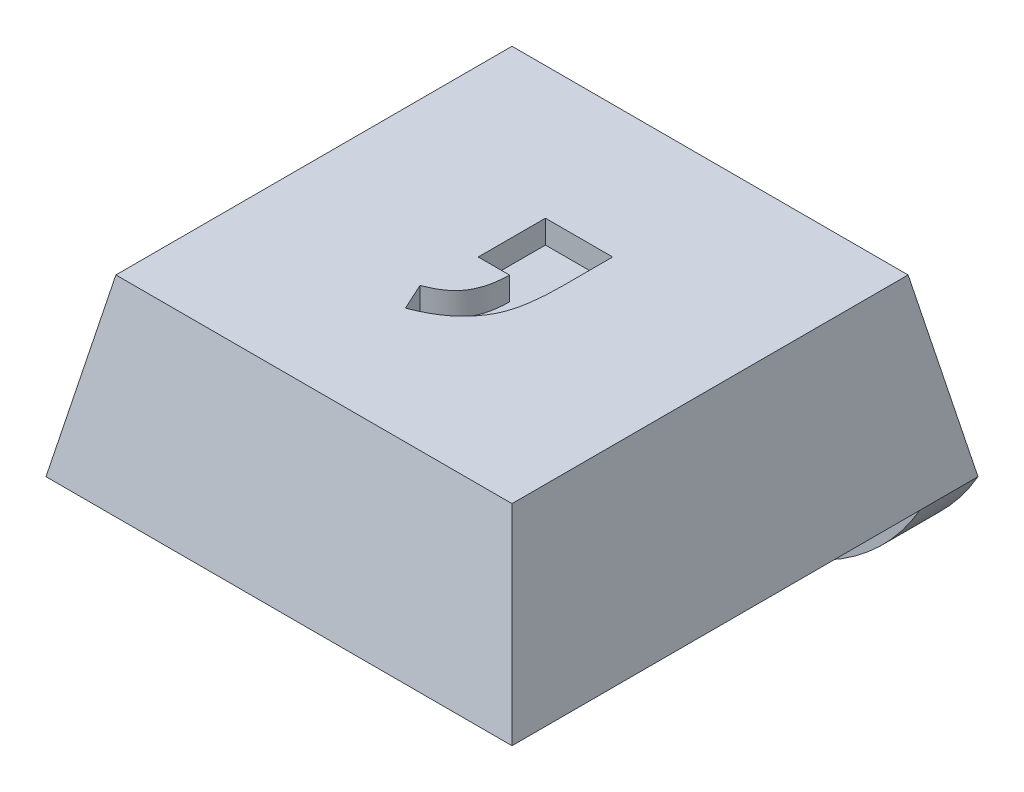
from build123d import *

# Parameters (mm, degrees)
SKETCH1_W               = 8
SKETCH1_H               = 8
BOSS_EXTRUDE1_DEPTH     = 3
CUT_EXTRUDE1_DEPTH      = 12.704699911
CUT_EXTRUDE1_DEPTH_BACK = 12.704699911
CUT_EXTRUDE2_DEPTH      = 11
SKETCH4_R               = 1.8
CUT_EXTRUDE3_DEPTH      = 0.8
SKETCH5_W               = 8
SKETCH5_H               = 1
BOSS_EXTRUDE2_DEPTH     = 2
FILLET1_R               = 4
CUT_EXTRUDE4_DEPTH      = 0.4


with BuildPart() as part:
    # Sketch1 → Boss-Extrude1 (new body)
    with BuildSketch(Plane(origin=(0, 0, 0), x_dir=(1, 0, 0), z_dir=(0, 1, 0))):
        with Locations((4, 4)):
            Rectangle(SKETCH1_W, SKETCH1_H)
    extrude(amount=BOSS_EXTRUDE1_DEPTH)

    # Sketch2 → Cut-Extrude1 (cut, two sides: drawn at the far end of the back side and taken through both)
    with BuildSketch(Plane.XY.offset(-CUT_EXTRUDE1_DEPTH_BACK)):
        Polygon((0, 0), (0.6, 3), (0, 3), align=None)
        Polygon((8, 0), (7.4, 3), (8, 3), align=None)
    extrude(amount=CUT_EXTRUDE1_DEPTH + CUT_EXTRUDE1_DEPTH_BACK, mode=Mode.SUBTRACT)

    # Sketch3 → Cut-Extrude2 (cut)
    with BuildSketch(Plane(origin=(0, 0, 0), x_dir=(0, 0, -1), z_dir=(1, 0, 0))):
        Polygon((0, 0), (0.6, 3), (0, 3), align=None)
        Polygon((8, 3), (7.4, 3), (8, 0), align=None)
    extrude(amount=CUT_EXTRUDE2_DEPTH, mode=Mode.SUBTRACT)

    # Sketch4 → Cut-Extrude3 (cut)
    with BuildSketch(Plane.XZ):
        with Locations(Location((4, -3.75, 0), (0, 0, 270))):
            Circle(SKETCH4_R)
    extrude(amount=-CUT_EXTRUDE3_DEPTH, mode=Mode.SUBTRACT)

    # Sketch5 → Boss-Extrude2 (add)
    with BuildSketch(Plane.XZ):
        with Locations((4, -7.5)):
            Rectangle(SKETCH5_W, SKETCH5_H)
    extrude(amount=BOSS_EXTRUDE2_DEPTH)

    # Fillet1
    # the kernel refuses this fillet: 4 mm, written as the material it takes off along each edge
    with BuildSketch(Plane(origin=(8, -2, -16.660254038), x_dir=(0, 1, 0), z_dir=(0, 0, 1)), Plane(origin=(0, -2, 1.660254038), x_dir=(0, 1, 0), z_dir=(0, 0, -1))) as fillet1_piece_1:
        with BuildLine():
            CenterArc((4, 3.464101615), FILLET1_R, 180, 60)
            Line((0, 3.464101615), (-0.08, 3.464101615))
            Line((-0.08, 3.464101615), (-0.08, 0))
            Line((-0.08, 0), (0, -0.08))
            ThreePointArc((0, -0.08), (1, -0.08), (1.96, -0.069282032))
            Line((1.96, -0.069282032), (2, 0))
        make_face()
    extrude(amount=18.320508076, mode=Mode.SUBTRACT)

    # Sketch6 → Cut-Extrude4 (cut)
    with BuildSketch(Plane(origin=(0, 3, 0), x_dir=(1, 0, 0), z_dir=(0, 1, 0))):
        with BuildLine():
            Line((3.443331895, 5.130686034), (4.597178049, 5.130686034))
            Line((4.597178049, 5.130686034), (4.597178049, 4.291743727))
            add(Edge.make_bspline(
                [(4.597178049, 4.291743727), (4.596645702, 4.211170655), (4.595640561, 4.059038126), (4.578021597, 3.844434295), (4.553540207, 3.655975372), (4.51459395, 3.491238943), (4.462448704, 3.342468302), (4.388723742, 3.206338125), (4.298056147, 3.076066307), (4.187154731, 2.955594738), (4.059577941, 2.844170634), (3.913847481, 2.747275335), (3.753421756, 2.660946408), (3.638168327, 2.615497851), (3.579149203, 2.592224496)],
                knots=[0, 0, 0, 0, 1.347156832, 2.543608823, 3.599300285, 4.522475688, 5.370350604, 6.227678973, 7.103274953, 8.018757603, 8.959280198, 9.929437417, 10.939703653, 12, 12, 12, 12], degree=3))
            Line((3.579149203, 2.592224496), (3.366408818, 3.053762957))
            add(Edge.make_bspline(
                [(3.366408818, 3.053762957), (3.417874874, 3.07492834), (3.516080495, 3.11531534), (3.647721841, 3.193115232), (3.754216523, 3.284666717), (3.839841548, 3.388423011), (3.901059293, 3.510472084), (3.947065575, 3.648752862), (3.973734578, 3.806802537), (3.979016553, 3.918249261), (3.981793434, 3.976839881)],
                knots=[0, 0, 0, 0, 1.113959817, 2.125616841, 3.047494432, 3.914868512, 4.801521967, 5.765947312, 6.825496818, 8, 8, 8, 8], degree=3))
            Line((3.981793434, 3.976839881), (3.443331895, 3.976839881))
            Line((3.443331895, 3.976839881), (3.443331895, 5.130686034))
        make_face()
    extrude(amount=-CUT_EXTRUDE4_DEPTH, mode=Mode.SUBTRACT)


solid = part.part
